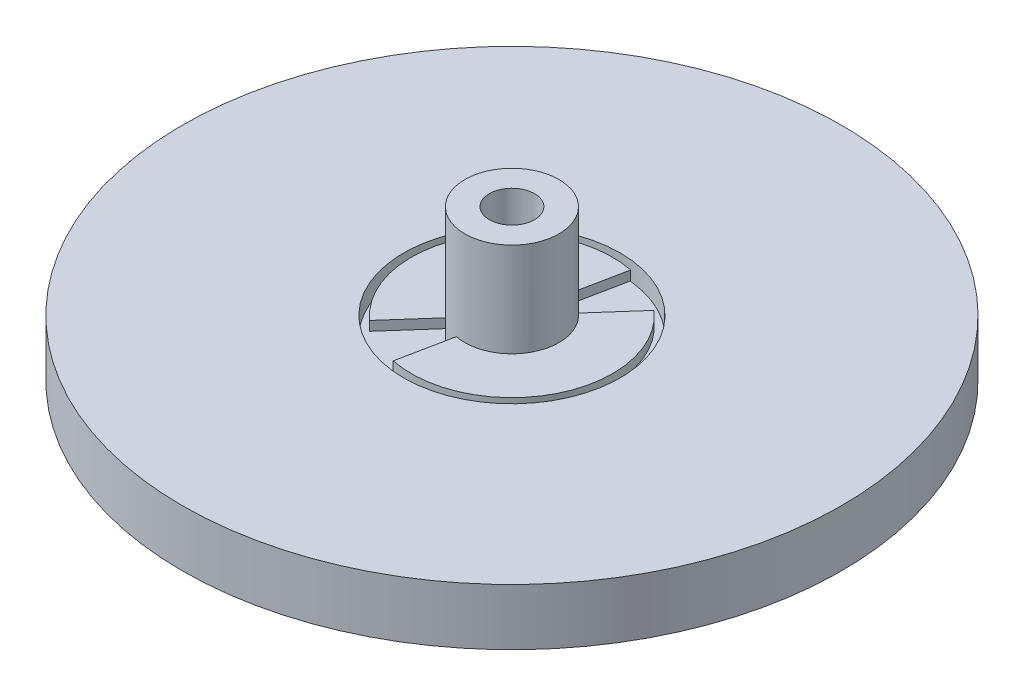
from build123d import *
from build123d.topology import SkipClean

# Parameters (mm, degrees)
SKETCH1_R                = 175
BOSS_EXTRUDE1_DEPTH      = 30
BOSS_EXTRUDE2_DEPTH      = 50
BOSS_EXTRUDE2_DEPTH_BACK = 15
SKETCH2_R                = 25
SKETCH2_R_2              = 12
SKETCH3_R                = 57.5
CUT_EXTRUDE1_DEPTH       = 10
SKETCH5_R                = 53.5
BOSS_EXTRUDE3_DEPTH      = 5
SKETCH6_R                = 25
BOSS_EXTRUDE4_DEPTH      = 15
CUT_EXTRUDE3_DEPTH       = 10


with BuildPart() as part:
    # Sketch1 → Boss-Extrude1 (new body)
    with BuildSketch(Plane(origin=(0, 0, 0), x_dir=(1, 0, 0), z_dir=(0, 1, 0))):
        Circle(SKETCH1_R)
    extrude(amount=BOSS_EXTRUDE1_DEPTH)

    # Sketch2 → Boss-Extrude2 (add, two sides: drawn at the far end of the back side and taken through both)
    with BuildSketch(Plane(origin=(0, 30, 0), x_dir=(1, 0, 0), z_dir=(0, 1, 0)).offset(-BOSS_EXTRUDE2_DEPTH_BACK)):
        Circle(SKETCH2_R)
        Circle(SKETCH2_R_2, mode=Mode.SUBTRACT)
    extrude(amount=BOSS_EXTRUDE2_DEPTH + BOSS_EXTRUDE2_DEPTH_BACK)

    # Sketch3 → Cut-Extrude1 (cut)
    with BuildSketch(Plane(origin=(0, 30, 0), x_dir=(1, 0, 0), z_dir=(0, 1, 0))):
        Circle(SKETCH3_R)
    extrude(amount=-CUT_EXTRUDE1_DEPTH, mode=Mode.SUBTRACT)


with BuildPart() as cut_extrude1_piece_1:
    # of the separate pieces the step leaves, piece 1, a body of its own (cut_extrude1_pieces)
    add(part.part.solids().sort_by_distance((175, 0, 0))[0])



with BuildPart() as cut_extrude1_piece_2:
    # of the separate pieces the step leaves, piece 2, a body of its own (cut_extrude1_pieces)
    add(part.part.solids().sort_by_distance((25, 30, 0))[0])

    # Sketch5 → Boss-Extrude3 (add)
    with BuildSketch(Plane.XZ.offset(-30)):
        Circle(SKETCH5_R)
    extrude(amount=BOSS_EXTRUDE3_DEPTH)


with BuildPart() as cut_extrude1_piece_1_1:
    add(cut_extrude1_piece_1.part)

    add(cut_extrude1_piece_2.part)  # Boss-Extrude4 merges Cut-Extrude1 piece 2
    # Sketch6 → Boss-Extrude4 (add)
    with BuildSketch(Plane(origin=(0, 30, 0), x_dir=(1, 0, 0), z_dir=(0, 1, 0))):
        Circle(SKETCH6_R)
    extrude(amount=-BOSS_EXTRUDE4_DEPTH)

    # Sketch7 → Cut-Extrude3 (cut)
    with SkipClean():  # the faces are left unmerged after this step: merging them gives an invalid solid
        with BuildSketch(Plane(origin=(0, 30, 0), x_dir=(1, 0, 0), z_dir=(0, 1, 0))):
            with BuildLine():
                Line((4.978816012, 24.499212051), (10.631919272, 52.432931375))
                ThreePointArc((10.631919272, 52.432931375), (23.850675594, 47.889406696), (35.44136855, 40.076918486))
                Line((35.44136855, 40.076918486), (16.561387173, 18.727532003))
                ThreePointArc((16.561387173, 18.727532003), (11.150029639, 22.375809238), (4.978816012, 24.499212051))
            make_face()
            with BuildLine():
                Line((-16.561387173, -18.727532003), (-35.44136855, -40.076918486))
                ThreePointArc((-35.44136855, -40.076918486), (-23.850675594, -47.889406696), (-10.631919272, -52.432931375))
                Line((-10.631919272, -52.432931375), (-4.978816012, -24.499212051))
                ThreePointArc((-4.978816012, -24.499212051), (-11.150029639, -22.375809238), (-16.561387173, -18.727532003))
            make_face()
        extrude(amount=-CUT_EXTRUDE3_DEPTH, mode=Mode.SUBTRACT)


solid = cut_extrude1_piece_1_1.part
